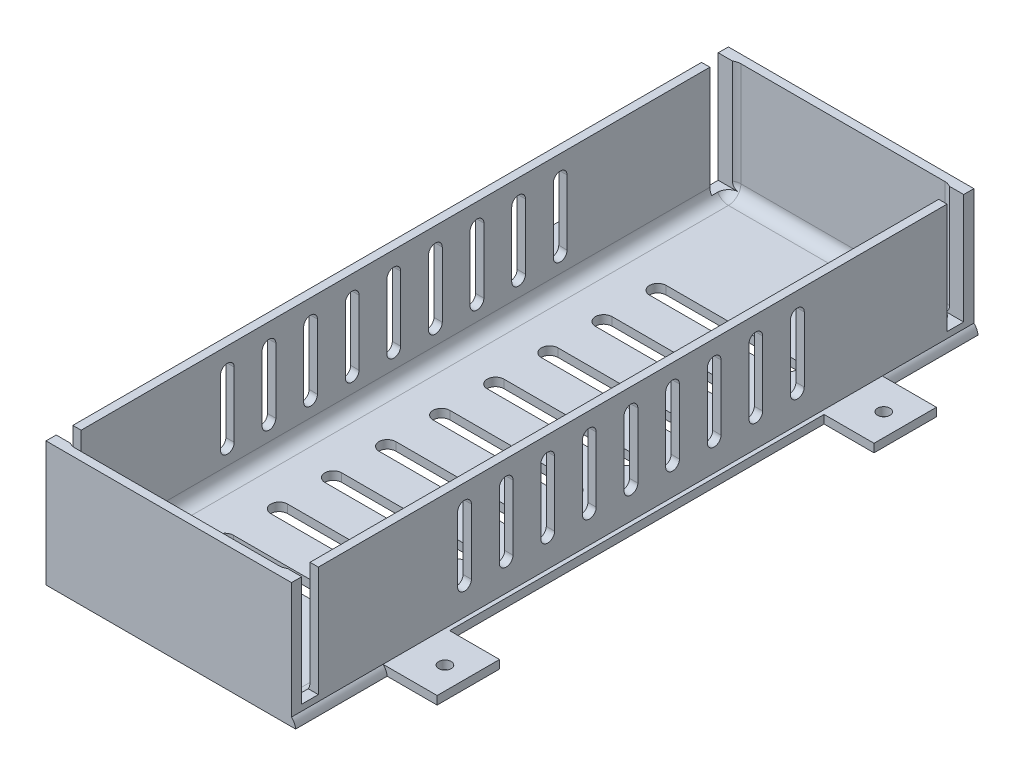
from build123d import *

# Parameters (mm, degrees)
SKETCH1_W               = 60
SKETCH1_H               = 164
BOSS_EXTRUDE1_DEPTH     = 2
SKETCH2_W               = 59
SKETCH2_H               = 164
SKETCH2_W_2             = 55
SKETCH2_H_2             = 160
BOSS_EXTRUDE2_DEPTH     = 28
SKETCH5_W               = 15
SKETCH5_H               = 2
BOSS_EXTRUDE5_DEPTH     = 12
FILLET3_R               = 3
FILLET4_R               = 3
MIRROR2_COPY_1_SKETCH_W = 15
MIRROR2_COPY_1_SKETCH_H = 2
MIRROR2_COPY_1_DEPTH    = 12
FILLET6_R               = 3
CUT_EXTRUDE6_REACH      = 115.172
CUT_EXTRUDE7_DEPTH      = 2
CUT_EXTRUDE8_START      = -59
SKETCH13_W              = 4
SKETCH13_H              = 26.533825547
CUT_EXTRUDE8_DEPTH      = 59
SKETCH14_R              = 1.5
CUT_EXTRUDE9_DEPTH      = 2
MIRROR5_COPY_1_SKETCH_R = 1.5
MIRROR5_COPY_1_DEPTH    = 2


with BuildPart() as part:
    # Sketch1 → Boss-Extrude1 (new body)
    with BuildSketch(Plane(origin=(0, 0, 0), x_dir=(1, 0, 0), z_dir=(0, 1, 0))):
        Rectangle(SKETCH1_W, SKETCH1_H)
    extrude(amount=BOSS_EXTRUDE1_DEPTH)

    # Sketch2 → Boss-Extrude2 (add)
    with BuildSketch(Plane(origin=(0, 2, 0), x_dir=(1, 0, 0), z_dir=(0, 1, 0))):
        with Locations((-0.5, 0)):
            Rectangle(SKETCH2_W, SKETCH2_H)
        with Locations((-0.5, 0)):
            Rectangle(SKETCH2_W_2, SKETCH2_H_2, mode=Mode.SUBTRACT)
    extrude(amount=BOSS_EXTRUDE2_DEPTH)

    # Sketch5 → Boss-Extrude5 (add)
    with BuildSketch(Plane(origin=(30, 0, 0), x_dir=(0, 0, -1), z_dir=(1, 0, 0))):
        with Locations((52.5, 1)):
            Rectangle(SKETCH5_W, SKETCH5_H)
    boss_extrude5 = extrude(amount=BOSS_EXTRUDE5_DEPTH)

    # Fillet3
    fillet3_edges = [part.edges().sort_by_distance(p)[0] for p in [
        (27, 16, -80),
        (-28, 16, -80),
        (-28, 16, 80),
        (27, 16, 80),
    ]]
    fillet(fillet3_edges, radius=FILLET3_R)

    # Fillet4
    fillet4_edges = [part.edges().sort_by_distance(p)[0] for p in [
        (-28, 2, 0),
        (-0.5, 2, 80),
        (27, 2, 0),
        (-0.5, 2, -80),
        (-27.121320344, 2, -79.121320344),
        (26.121320344, 2, -79.121320344),
        (26.121320344, 2, 79.121320344),
        (-27.121320344, 2, 79.121320344),
    ]]
    fillet(fillet4_edges, radius=FILLET4_R)

    # Mirror1: Boss-Extrude5 across plane
    add(boss_extrude5.mirror(Plane.XY))

    # Mirror2: Boss-Extrude5 across plane
    add(boss_extrude5.mirror(Plane(origin=(0, 0, 0), x_dir=(0, 0, 1), z_dir=(1, 0, 0))))

    # Mirror2 copy 1 sketch → Mirror2 copy 1 (add)
    with BuildSketch(Plane.ZY.offset(30)):
        with Locations((52.5, 1)):
            Rectangle(MIRROR2_COPY_1_SKETCH_W, MIRROR2_COPY_1_SKETCH_H)
    extrude(amount=MIRROR2_COPY_1_DEPTH)

    # Fillet6
    # the kernel refuses this fillet: 3 mm, written as the material it adds along each edge
    with BuildSketch(Plane(origin=(-30, 2, -45), x_dir=(0, 1, 0), z_dir=(0, 0, -1))) as fillet6_piece_1:
        with BuildLine():
            CenterArc((FILLET6_R, -FILLET6_R), FILLET6_R, 90, 90)
            Line((0, -FILLET6_R), (0, 0))
            Line((0, 0), (FILLET6_R, 0))
        make_face()
    extrude(amount=15)
    with BuildSketch(Plane(origin=(-30, 2, 45), x_dir=(0, 1, 0), z_dir=(0, 0, 1))) as fillet6_piece_2:
        with BuildLine():
            CenterArc((FILLET6_R, FILLET6_R), FILLET6_R, 180, 90)
            Line((0, FILLET6_R), (0, 0))
            Line((0, 0), (FILLET6_R, 0))
        make_face()
    extrude(amount=15)
    # the kernel refuses this fillet: 3 mm, written as the material it takes off along each edge
    with BuildSketch(Plane(origin=(30, 2, -87.590169944), x_dir=(-1, 0, 0), z_dir=(0, 0, 1))) as fillet6_2_piece_1:
        with BuildLine():
            CenterArc((3, 2.236067977), FILLET6_R, 180, 48.189685104)
            Line((0, 2.236067977), (0, 0))
            Line((0, 0), (1, 0))
        make_face()
    extrude(amount=27.590169944, mode=Mode.SUBTRACT)
    with BuildSketch(Plane(origin=(30, 2, 60), x_dir=(0, -1, 0), z_dir=(0, 0, 1))) as fillet6_2_piece_2:
        with BuildLine():
            CenterArc((2.236067977, -3), FILLET6_R, 90, 48.189685104)
            Line((0, -1), (0, 0))
            Line((0, 0), (2.236067977, 0))
        make_face()
    extrude(amount=27.590169944, mode=Mode.SUBTRACT)

    # Cut-Extrude6: up to this face of the body (flat: up to its plane)
    cut_extrude6_end = Plane(part.part.faces().sort_by_distance((29, 16, 0))[0])
    # Sketch11 → Cut-Extrude6 (cut, up to the picked face)
    with BuildSketch(Plane.ZY.offset(30), mode=Mode.PRIVATE) as cut_extrude6_sk1:
        with BuildLine():
            Line((-37.933781792, 24.7205503), (-37.933781792, 9.085662212))
            ThreePointArc((-37.933781792, 9.085662212), (-39.584538645, 7.434905359), (-41.235295497, 9.085662212))
            Line((-41.235295497, 9.085662212), (-41.235295497, 24.7205503))
            ThreePointArc((-41.235295497, 24.7205503), (-39.584538645, 26.371307152), (-37.933781792, 24.7205503))
        make_face()
    cut_extrude6_tool1 = split(extrude(cut_extrude6_sk1.sketch, amount=-CUT_EXTRUDE6_REACH, mode=Mode.PRIVATE), bisect_by=cut_extrude6_end, keep=Keep.BOTH, mode=Mode.PRIVATE)
    # Sketch11 → Cut-Extrude6 (cut, up to the picked face)
    with BuildSketch(Plane.ZY.offset(30), mode=Mode.PRIVATE) as cut_extrude6_sk2:
        with BuildLine():
            Line((-27.933781792, 24.7205503), (-27.933781792, 9.085662212))
            ThreePointArc((-27.933781792, 9.085662212), (-29.584538645, 7.434905359), (-31.235295497, 9.085662212))
            Line((-31.235295497, 9.085662212), (-31.235295497, 24.7205503))
            ThreePointArc((-31.235295497, 24.7205503), (-29.584538645, 26.371307152), (-27.933781792, 24.7205503))
        make_face()
    cut_extrude6_tool2 = split(extrude(cut_extrude6_sk2.sketch, amount=-CUT_EXTRUDE6_REACH, mode=Mode.PRIVATE), bisect_by=cut_extrude6_end, keep=Keep.BOTH, mode=Mode.PRIVATE)
    # Sketch11 → Cut-Extrude6 (cut, up to the picked face)
    with BuildSketch(Plane.ZY.offset(30), mode=Mode.PRIVATE) as cut_extrude6_sk3:
        with BuildLine():
            Line((-17.933781792, 24.7205503), (-17.933781792, 9.085662212))
            ThreePointArc((-17.933781792, 9.085662212), (-19.584538645, 7.434905359), (-21.235295497, 9.085662212))
            Line((-21.235295497, 9.085662212), (-21.235295497, 24.7205503))
            ThreePointArc((-21.235295497, 24.7205503), (-19.584538645, 26.371307152), (-17.933781792, 24.7205503))
        make_face()
    cut_extrude6_tool3 = split(extrude(cut_extrude6_sk3.sketch, amount=-CUT_EXTRUDE6_REACH, mode=Mode.PRIVATE), bisect_by=cut_extrude6_end, keep=Keep.BOTH, mode=Mode.PRIVATE)
    # Sketch11 → Cut-Extrude6 (cut, up to the picked face)
    with BuildSketch(Plane.ZY.offset(30), mode=Mode.PRIVATE) as cut_extrude6_sk4:
        with BuildLine():
            Line((-7.933781792, 24.7205503), (-7.933781792, 9.085662212))
            ThreePointArc((-7.933781792, 9.085662212), (-9.584538645, 7.434905359), (-11.235295497, 9.085662212))
            Line((-11.235295497, 9.085662212), (-11.235295497, 24.7205503))
            ThreePointArc((-11.235295497, 24.7205503), (-9.584538645, 26.371307152), (-7.933781792, 24.7205503))
        make_face()
    cut_extrude6_tool4 = split(extrude(cut_extrude6_sk4.sketch, amount=-CUT_EXTRUDE6_REACH, mode=Mode.PRIVATE), bisect_by=cut_extrude6_end, keep=Keep.BOTH, mode=Mode.PRIVATE)
    # Sketch11 → Cut-Extrude6 (cut, up to the picked face)
    with BuildSketch(Plane.ZY.offset(30), mode=Mode.PRIVATE) as cut_extrude6_sk5:
        with BuildLine():
            Line((2.066218208, 24.7205503), (2.066218208, 9.085662212))
            ThreePointArc((2.066218208, 9.085662212), (0.415461355, 7.434905359), (-1.235295497, 9.085662212))
            Line((-1.235295497, 9.085662212), (-1.235295497, 24.7205503))
            ThreePointArc((-1.235295497, 24.7205503), (0.415461355, 26.371307152), (2.066218208, 24.7205503))
        make_face()
    cut_extrude6_tool5 = split(extrude(cut_extrude6_sk5.sketch, amount=-CUT_EXTRUDE6_REACH, mode=Mode.PRIVATE), bisect_by=cut_extrude6_end, keep=Keep.BOTH, mode=Mode.PRIVATE)
    # Sketch11 → Cut-Extrude6 (cut, up to the picked face)
    with BuildSketch(Plane.ZY.offset(30), mode=Mode.PRIVATE) as cut_extrude6_sk6:
        with BuildLine():
            Line((12.066218208, 24.7205503), (12.066218208, 9.085662212))
            ThreePointArc((12.066218208, 9.085662212), (10.415461355, 7.434905359), (8.764704503, 9.085662212))
            Line((8.764704503, 9.085662212), (8.764704503, 24.7205503))
            ThreePointArc((8.764704503, 24.7205503), (10.415461355, 26.371307152), (12.066218208, 24.7205503))
        make_face()
    cut_extrude6_tool6 = split(extrude(cut_extrude6_sk6.sketch, amount=-CUT_EXTRUDE6_REACH, mode=Mode.PRIVATE), bisect_by=cut_extrude6_end, keep=Keep.BOTH, mode=Mode.PRIVATE)
    # Sketch11 → Cut-Extrude6 (cut, up to the picked face)
    with BuildSketch(Plane.ZY.offset(30), mode=Mode.PRIVATE) as cut_extrude6_sk7:
        with BuildLine():
            Line((22.066218208, 24.7205503), (22.066218208, 9.085662212))
            ThreePointArc((22.066218208, 9.085662212), (20.415461355, 7.434905359), (18.764704503, 9.085662212))
            Line((18.764704503, 9.085662212), (18.764704503, 24.7205503))
            ThreePointArc((18.764704503, 24.7205503), (20.415461355, 26.371307152), (22.066218208, 24.7205503))
        make_face()
    cut_extrude6_tool7 = split(extrude(cut_extrude6_sk7.sketch, amount=-CUT_EXTRUDE6_REACH, mode=Mode.PRIVATE), bisect_by=cut_extrude6_end, keep=Keep.BOTH, mode=Mode.PRIVATE)
    # Sketch11 → Cut-Extrude6 (cut, up to the picked face)
    with BuildSketch(Plane.ZY.offset(30), mode=Mode.PRIVATE) as cut_extrude6_sk8:
        with BuildLine():
            Line((32.066218208, 24.7205503), (32.066218208, 9.085662212))
            ThreePointArc((32.066218208, 9.085662212), (30.415461355, 7.434905359), (28.764704503, 9.085662212))
            Line((28.764704503, 9.085662212), (28.764704503, 24.7205503))
            ThreePointArc((28.764704503, 24.7205503), (30.415461355, 26.371307152), (32.066218208, 24.7205503))
        make_face()
    cut_extrude6_tool8 = split(extrude(cut_extrude6_sk8.sketch, amount=-CUT_EXTRUDE6_REACH, mode=Mode.PRIVATE), bisect_by=cut_extrude6_end, keep=Keep.BOTH, mode=Mode.PRIVATE)
    # Sketch11 → Cut-Extrude6 (cut, up to the picked face)
    with BuildSketch(Plane.ZY.offset(30), mode=Mode.PRIVATE) as cut_extrude6_sk9:
        with BuildLine():
            Line((42.066218208, 24.7205503), (42.066218208, 9.085662212))
            ThreePointArc((42.066218208, 9.085662212), (40.415461355, 7.434905359), (38.764704503, 9.085662212))
            Line((38.764704503, 9.085662212), (38.764704503, 24.7205503))
            ThreePointArc((38.764704503, 24.7205503), (40.415461355, 26.371307152), (42.066218208, 24.7205503))
        make_face()
    cut_extrude6_tool9 = split(extrude(cut_extrude6_sk9.sketch, amount=-CUT_EXTRUDE6_REACH, mode=Mode.PRIVATE), bisect_by=cut_extrude6_end, keep=Keep.BOTH, mode=Mode.PRIVATE)
    add(cut_extrude6_tool1.solids().sort_by(Axis((-30, 16.903106, -39.584539), (1, 0, 0)))[0], mode=Mode.SUBTRACT)
    add(cut_extrude6_tool2.solids().sort_by(Axis((-30, 16.903106, -29.584539), (1, 0, 0)))[0], mode=Mode.SUBTRACT)
    add(cut_extrude6_tool3.solids().sort_by(Axis((-30, 16.903106, -19.584539), (1, 0, 0)))[0], mode=Mode.SUBTRACT)
    add(cut_extrude6_tool4.solids().sort_by(Axis((-30, 16.903106, -9.584539), (1, 0, 0)))[0], mode=Mode.SUBTRACT)
    add(cut_extrude6_tool5.solids().sort_by(Axis((-30, 16.903106, 0.415461), (1, 0, 0)))[0], mode=Mode.SUBTRACT)
    add(cut_extrude6_tool6.solids().sort_by(Axis((-30, 16.903106, 10.415461), (1, 0, 0)))[0], mode=Mode.SUBTRACT)
    add(cut_extrude6_tool7.solids().sort_by(Axis((-30, 16.903106, 20.415461), (1, 0, 0)))[0], mode=Mode.SUBTRACT)
    add(cut_extrude6_tool8.solids().sort_by(Axis((-30, 16.903106, 30.415461), (1, 0, 0)))[0], mode=Mode.SUBTRACT)
    add(cut_extrude6_tool9.solids().sort_by(Axis((-30, 16.903106, 40.415461), (1, 0, 0)))[0], mode=Mode.SUBTRACT)

    # Sketch12 → Cut-Extrude7 (cut)
    with BuildSketch(Plane(origin=(0, 2, 0), x_dir=(1, 0, 0), z_dir=(0, 1, 0))):
        with BuildLine():
            Line((-15.82803947, 52.887866444), (15.353348111, 52.887866444))
            ThreePointArc((15.353348111, 52.887866444), (17.370019398, 50.871195156), (15.353348111, 48.854523868))
            Line((15.353348111, 48.854523868), (-15.82803947, 48.854523868))
            ThreePointArc((-15.82803947, 48.854523868), (-17.844710758, 50.871195156), (-15.82803947, 52.887866444))
        make_face()
        with BuildLine():
            Line((-15.82803947, 39.887866444), (15.353348111, 39.887866444))
            ThreePointArc((15.353348111, 39.887866444), (17.370019398, 37.871195156), (15.353348111, 35.854523868))
            Line((15.353348111, 35.854523868), (-15.82803947, 35.854523868))
            ThreePointArc((-15.82803947, 35.854523868), (-17.844710758, 37.871195156), (-15.82803947, 39.887866444))
        make_face()
        with BuildLine():
            Line((-15.82803947, 26.887866444), (15.353348111, 26.887866444))
            ThreePointArc((15.353348111, 26.887866444), (17.370019398, 24.871195156), (15.353348111, 22.854523868))
            Line((15.353348111, 22.854523868), (-15.82803947, 22.854523868))
            ThreePointArc((-15.82803947, 22.854523868), (-17.844710758, 24.871195156), (-15.82803947, 26.887866444))
        make_face()
        with BuildLine():
            Line((-15.82803947, 13.887866444), (15.353348111, 13.887866444))
            ThreePointArc((15.353348111, 13.887866444), (17.370019398, 11.871195156), (15.353348111, 9.854523868))
            Line((15.353348111, 9.854523868), (-15.82803947, 9.854523868))
            ThreePointArc((-15.82803947, 9.854523868), (-17.844710758, 11.871195156), (-15.82803947, 13.887866444))
        make_face()
        with BuildLine():
            Line((-15.82803947, 0.887866444), (15.353348111, 0.887866444))
            ThreePointArc((15.353348111, 0.887866444), (17.370019398, -1.128804844), (15.353348111, -3.145476132))
            Line((15.353348111, -3.145476132), (-15.82803947, -3.145476132))
            ThreePointArc((-15.82803947, -3.145476132), (-17.844710758, -1.128804844), (-15.82803947, 0.887866444))
        make_face()
        with BuildLine():
            Line((-15.82803947, -12.112133556), (15.353348111, -12.112133556))
            ThreePointArc((15.353348111, -12.112133556), (17.370019398, -14.128804844), (15.353348111, -16.145476132))
            Line((15.353348111, -16.145476132), (-15.82803947, -16.145476132))
            ThreePointArc((-15.82803947, -16.145476132), (-17.844710758, -14.128804844), (-15.82803947, -12.112133556))
        make_face()
        with BuildLine():
            Line((-15.82803947, -25.112133556), (15.353348111, -25.112133556))
            ThreePointArc((15.353348111, -25.112133556), (17.370019398, -27.128804844), (15.353348111, -29.145476132))
            Line((15.353348111, -29.145476132), (-15.82803947, -29.145476132))
            ThreePointArc((-15.82803947, -29.145476132), (-17.844710758, -27.128804844), (-15.82803947, -25.112133556))
        make_face()
        with BuildLine():
            Line((-15.82803947, -38.112133556), (15.353348111, -38.112133556))
            ThreePointArc((15.353348111, -38.112133556), (17.370019398, -40.128804844), (15.353348111, -42.145476132))
            Line((15.353348111, -42.145476132), (-15.82803947, -42.145476132))
            ThreePointArc((-15.82803947, -42.145476132), (-17.844710758, -40.128804844), (-15.82803947, -38.112133556))
        make_face()
        with BuildLine():
            Line((-15.82803947, -51.112133556), (15.353348111, -51.112133556))
            ThreePointArc((15.353348111, -51.112133556), (17.370019398, -53.128804844), (15.353348111, -55.145476132))
            Line((15.353348111, -55.145476132), (-15.82803947, -55.145476132))
            ThreePointArc((-15.82803947, -55.145476132), (-17.844710758, -53.128804844), (-15.82803947, -51.112133556))
        make_face()
    extrude(amount=-CUT_EXTRUDE7_DEPTH, mode=Mode.SUBTRACT)

    # Sketch13 → Cut-Extrude8 (cut)
    with BuildSketch(Plane(origin=(29, 0, 0), x_dir=(0, 0, -1), z_dir=(1, 0, 0)).offset(CUT_EXTRUDE8_START)):
        with Locations((-77.550098336, 16.733087227)):
            Rectangle(SKETCH13_W, SKETCH13_H)
    cut_extrude8 = extrude(amount=CUT_EXTRUDE8_DEPTH, mode=Mode.SUBTRACT)

    # Mirror3: Cut-Extrude8 across plane
    add(cut_extrude8.mirror(Plane.XY), mode=Mode.SUBTRACT)

    # Sketch14 → Cut-Extrude9 (cut)
    with BuildSketch(Plane(origin=(0, 2, 0), x_dir=(1, 0, 0), z_dir=(0, 1, 0))):
        with Locations(Location((36.605250478, -52.726333191, 0), (0, 0, 270))):
            Circle(SKETCH14_R)
    cut_extrude9 = extrude(amount=-CUT_EXTRUDE9_DEPTH, mode=Mode.SUBTRACT)

    # Mirror4: Cut-Extrude9 across plane
    add(cut_extrude9.mirror(Plane.XY), mode=Mode.SUBTRACT)

    # Mirror5: Cut-Extrude9 across plane
    add(cut_extrude9.mirror(Plane(origin=(0, 0, 0), x_dir=(0, 0, 1), z_dir=(1, 0, 0))), mode=Mode.SUBTRACT)

    # Mirror5 copy 1 sketch → Mirror5 copy 1 (cut)
    with BuildSketch(Plane(origin=(0, 2, 0), x_dir=(-1, 0, 0), z_dir=(0, 1, 0))):
        with Locations(Location((36.605250478, -52.726333191, 0), (0, 0, 270))):
            Circle(MIRROR5_COPY_1_SKETCH_R)
    extrude(amount=-MIRROR5_COPY_1_DEPTH, mode=Mode.SUBTRACT)


solid = part.part
